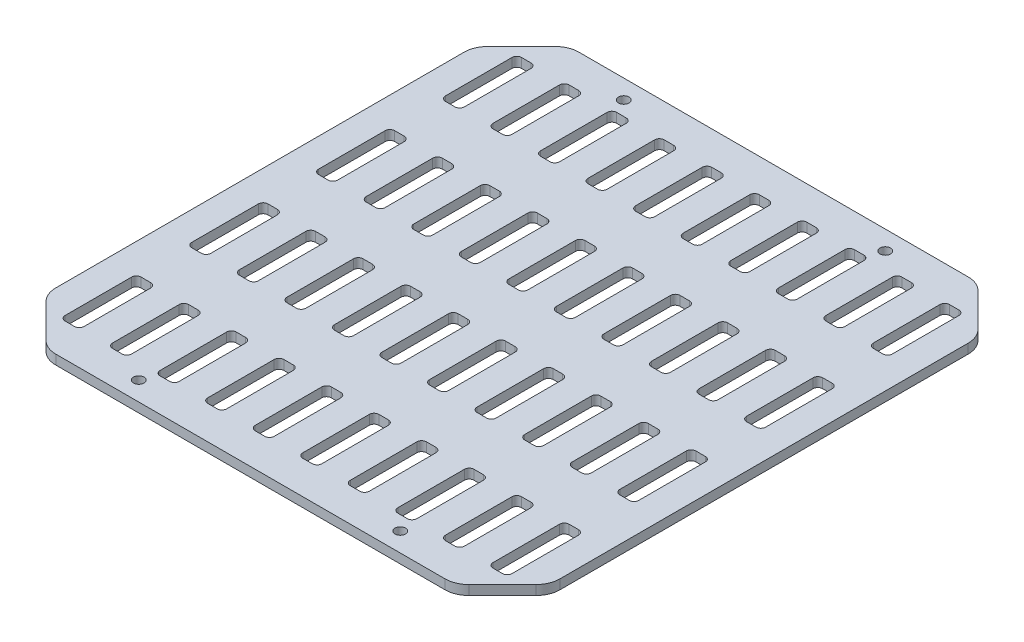
from build123d import *

# Parameters (mm, degrees)
SKETCH_1_W      = 106
SKETCH_1_H      = 110
SKETCH_1_R      = 1.1
SKETCH_1_W_2    = 4
SKETCH_1_H_2    = 16
EXTRUDE_1_DEPTH = 2
CHAMFER_1_SIZE  = 10
FILLET_1_R      = 5
FILLET_2_R      = 1


with BuildPart() as part:
    # 草图1 → 凸台-拉伸1 (new body)
    with BuildSketch(Plane(origin=(0, 0, 0), x_dir=(1, 0, 0), z_dir=(0, 1, 0))):
        Rectangle(SKETCH_1_W, SKETCH_1_H)
        with Locations((-27.5, 51)):
            Circle(SKETCH_1_R, mode=Mode.SUBTRACT)
        with Locations((27.5, 51)):
            Circle(SKETCH_1_R, mode=Mode.SUBTRACT)
        with Locations((27.5, -51)):
            Circle(SKETCH_1_R, mode=Mode.SUBTRACT)
        with Locations((-27.5, -51)):
            Circle(SKETCH_1_R, mode=Mode.SUBTRACT)
        with Locations((-35, 40)):
            Rectangle(SKETCH_1_W_2, SKETCH_1_H_2, mode=Mode.SUBTRACT)
        with Locations((-45, 40)):
            Rectangle(SKETCH_1_W_2, SKETCH_1_H_2, mode=Mode.SUBTRACT)
        with Locations((-25, 40)):
            Rectangle(SKETCH_1_W_2, SKETCH_1_H_2, mode=Mode.SUBTRACT)
        with Locations((-15, 40)):
            Rectangle(SKETCH_1_W_2, SKETCH_1_H_2, mode=Mode.SUBTRACT)
        with Locations((-5, 40)):
            Rectangle(SKETCH_1_W_2, SKETCH_1_H_2, mode=Mode.SUBTRACT)
        with Locations((5, 40)):
            Rectangle(SKETCH_1_W_2, SKETCH_1_H_2, mode=Mode.SUBTRACT)
        with Locations((15, 40)):
            Rectangle(SKETCH_1_W_2, SKETCH_1_H_2, mode=Mode.SUBTRACT)
        with Locations((25, 40)):
            Rectangle(SKETCH_1_W_2, SKETCH_1_H_2, mode=Mode.SUBTRACT)
        with Locations((35, 40)):
            Rectangle(SKETCH_1_W_2, SKETCH_1_H_2, mode=Mode.SUBTRACT)
        with Locations((45, 40)):
            Rectangle(SKETCH_1_W_2, SKETCH_1_H_2, mode=Mode.SUBTRACT)
        with Locations((-35, 13.333333333)):
            Rectangle(SKETCH_1_W_2, SKETCH_1_H_2, mode=Mode.SUBTRACT)
        with Locations((-25, 13.333333333)):
            Rectangle(SKETCH_1_W_2, SKETCH_1_H_2, mode=Mode.SUBTRACT)
        with Locations((-15, 13.333333333)):
            Rectangle(SKETCH_1_W_2, SKETCH_1_H_2, mode=Mode.SUBTRACT)
        with Locations((-5, 13.333333333)):
            Rectangle(SKETCH_1_W_2, SKETCH_1_H_2, mode=Mode.SUBTRACT)
        with Locations((5, 13.333333333)):
            Rectangle(SKETCH_1_W_2, SKETCH_1_H_2, mode=Mode.SUBTRACT)
        with Locations((15, 13.333333333)):
            Rectangle(SKETCH_1_W_2, SKETCH_1_H_2, mode=Mode.SUBTRACT)
        with Locations((25, 13.333333333)):
            Rectangle(SKETCH_1_W_2, SKETCH_1_H_2, mode=Mode.SUBTRACT)
        with Locations((35, 13.333333333)):
            Rectangle(SKETCH_1_W_2, SKETCH_1_H_2, mode=Mode.SUBTRACT)
        with Locations((45, 13.333333333)):
            Rectangle(SKETCH_1_W_2, SKETCH_1_H_2, mode=Mode.SUBTRACT)
        with Locations((-35, -13.333333333)):
            Rectangle(SKETCH_1_W_2, SKETCH_1_H_2, mode=Mode.SUBTRACT)
        with Locations((-25, -13.333333333)):
            Rectangle(SKETCH_1_W_2, SKETCH_1_H_2, mode=Mode.SUBTRACT)
        with Locations((-15, -13.333333333)):
            Rectangle(SKETCH_1_W_2, SKETCH_1_H_2, mode=Mode.SUBTRACT)
        with Locations((-5, -13.333333333)):
            Rectangle(SKETCH_1_W_2, SKETCH_1_H_2, mode=Mode.SUBTRACT)
        with Locations((5, -13.333333333)):
            Rectangle(SKETCH_1_W_2, SKETCH_1_H_2, mode=Mode.SUBTRACT)
        with Locations((15, -13.333333333)):
            Rectangle(SKETCH_1_W_2, SKETCH_1_H_2, mode=Mode.SUBTRACT)
        with Locations((25, -13.333333333)):
            Rectangle(SKETCH_1_W_2, SKETCH_1_H_2, mode=Mode.SUBTRACT)
        with Locations((35, -13.333333333)):
            Rectangle(SKETCH_1_W_2, SKETCH_1_H_2, mode=Mode.SUBTRACT)
        with Locations((45, -13.333333333)):
            Rectangle(SKETCH_1_W_2, SKETCH_1_H_2, mode=Mode.SUBTRACT)
        with Locations((-35, -40)):
            Rectangle(SKETCH_1_W_2, SKETCH_1_H_2, mode=Mode.SUBTRACT)
        with Locations((-25, -40)):
            Rectangle(SKETCH_1_W_2, SKETCH_1_H_2, mode=Mode.SUBTRACT)
        with Locations((-15, -40)):
            Rectangle(SKETCH_1_W_2, SKETCH_1_H_2, mode=Mode.SUBTRACT)
        with Locations((-5, -40)):
            Rectangle(SKETCH_1_W_2, SKETCH_1_H_2, mode=Mode.SUBTRACT)
        with Locations((5, -40)):
            Rectangle(SKETCH_1_W_2, SKETCH_1_H_2, mode=Mode.SUBTRACT)
        with Locations((15, -40)):
            Rectangle(SKETCH_1_W_2, SKETCH_1_H_2, mode=Mode.SUBTRACT)
        with Locations((25, -40)):
            Rectangle(SKETCH_1_W_2, SKETCH_1_H_2, mode=Mode.SUBTRACT)
        with Locations((35, -40)):
            Rectangle(SKETCH_1_W_2, SKETCH_1_H_2, mode=Mode.SUBTRACT)
        with Locations((45, -40)):
            Rectangle(SKETCH_1_W_2, SKETCH_1_H_2, mode=Mode.SUBTRACT)
        with Locations((-45, 13.333333333)):
            Rectangle(SKETCH_1_W_2, SKETCH_1_H_2, mode=Mode.SUBTRACT)
        with Locations((-45, -13.333333333)):
            Rectangle(SKETCH_1_W_2, SKETCH_1_H_2, mode=Mode.SUBTRACT)
        with Locations((-45, -40)):
            Rectangle(SKETCH_1_W_2, SKETCH_1_H_2, mode=Mode.SUBTRACT)
    extrude(amount=EXTRUDE_1_DEPTH)

    # 倒角1
    chamfer_1_edges = [part.edges().sort_by_distance(p)[0] for p in [
        (53, 1, -55),
        (53, 1, 55),
        (-53, 1, 55),
        (-53, 1, -55),
    ]]
    chamfer(chamfer_1_edges, length=CHAMFER_1_SIZE)

    # 圆角1
    fillet_1_edges = [part.edges().sort_by_distance(p)[0] for p in [
        (-53, 1, 45),
        (-43, 1, 55),
        (43, 1, 55),
        (53, 1, 45),
        (53, 1, -45),
        (43, 1, -55),
        (-43, 1, -55),
        (-53, 1, -45),
    ]]
    fillet(fillet_1_edges, radius=FILLET_1_R)

    # 圆角2
    fillet_2_edges = [part.edges().sort_by_distance(p)[0] for p in [
        (-43, 1, 32),
        (-47, 1, 32),
        (-47, 1, 48),
        (-43, 1, 48),
        (-43, 1, 5.333333333),
        (-47, 1, 5.333333333),
        (-47, 1, 21.333333333),
        (-43, 1, 21.333333333),
        (-43, 1, -21.333333333),
        (-47, 1, -21.333333333),
        (-47, 1, -5.333333333),
        (-43, 1, -5.333333333),
        (47, 1, 32),
        (43, 1, 32),
        (43, 1, 48),
        (47, 1, 48),
        (37, 1, 32),
        (33, 1, 32),
        (33, 1, 48),
        (37, 1, 48),
        (27, 1, 32),
        (23, 1, 32),
        (23, 1, 48),
        (27, 1, 48),
        (17, 1, 32),
        (13, 1, 32),
        (13, 1, 48),
        (17, 1, 48),
        (7, 1, 32),
        (3, 1, 32),
        (3, 1, 48),
        (7, 1, 48),
        (-3, 1, 32),
        (-7, 1, 32),
        (-7, 1, 48),
        (-3, 1, 48),
        (-13, 1, 32),
        (-17, 1, 32),
        (-17, 1, 48),
        (-13, 1, 48),
        (-23, 1, 32),
        (-27, 1, 32),
        (-27, 1, 48),
        (-23, 1, 48),
        (-33, 1, 32),
        (-37, 1, 32),
        (-37, 1, 48),
        (-33, 1, 48),
        (47, 1, 5.333333333),
        (43, 1, 5.333333333),
        (43, 1, 21.333333333),
        (47, 1, 21.333333333),
        (37, 1, 5.333333333),
        (33, 1, 5.333333333),
        (33, 1, 21.333333333),
        (37, 1, 21.333333333),
        (27, 1, 5.333333333),
        (23, 1, 5.333333333),
        (23, 1, 21.333333333),
        (27, 1, 21.333333333),
        (17, 1, 5.333333333),
        (13, 1, 5.333333333),
        (13, 1, 21.333333333),
        (17, 1, 21.333333333),
        (7, 1, 5.333333333),
        (3, 1, 5.333333333),
        (3, 1, 21.333333333),
        (7, 1, 21.333333333),
        (-3, 1, 5.333333333),
        (-7, 1, 5.333333333),
        (-7, 1, 21.333333333),
        (-3, 1, 21.333333333),
        (-13, 1, 5.333333333),
        (-17, 1, 5.333333333),
        (-17, 1, 21.333333333),
        (-13, 1, 21.333333333),
        (-23, 1, 5.333333333),
        (-27, 1, 5.333333333),
        (-27, 1, 21.333333333),
        (-23, 1, 21.333333333),
        (-33, 1, 5.333333333),
        (-37, 1, 5.333333333),
        (-37, 1, 21.333333333),
        (-33, 1, 21.333333333),
        (47, 1, -21.333333333),
        (43, 1, -21.333333333),
        (43, 1, -5.333333333),
        (47, 1, -5.333333333),
        (37, 1, -21.333333333),
        (33, 1, -21.333333333),
        (33, 1, -5.333333333),
        (37, 1, -5.333333333),
        (27, 1, -21.333333333),
        (23, 1, -21.333333333),
        (23, 1, -5.333333333),
        (27, 1, -5.333333333),
        (17, 1, -21.333333333),
        (13, 1, -21.333333333),
        (13, 1, -5.333333333),
        (17, 1, -5.333333333),
        (7, 1, -21.333333333),
        (3, 1, -21.333333333),
        (3, 1, -5.333333333),
        (7, 1, -5.333333333),
        (-3, 1, -21.333333333),
        (-7, 1, -21.333333333),
        (-7, 1, -5.333333333),
        (-3, 1, -5.333333333),
        (-13, 1, -21.333333333),
        (-17, 1, -21.333333333),
        (-17, 1, -5.333333333),
        (-13, 1, -5.333333333),
        (-23, 1, -21.333333333),
        (-27, 1, -21.333333333),
        (-27, 1, -5.333333333),
        (-23, 1, -5.333333333),
        (-33, 1, -21.333333333),
        (-37, 1, -21.333333333),
        (-37, 1, -5.333333333),
        (-33, 1, -5.333333333),
        (47, 1, -48),
        (43, 1, -48),
        (43, 1, -32),
        (47, 1, -32),
        (37, 1, -48),
        (33, 1, -48),
        (33, 1, -32),
        (37, 1, -32),
        (27, 1, -48),
        (23, 1, -48),
        (23, 1, -32),
        (27, 1, -32),
        (17, 1, -48),
        (13, 1, -48),
        (13, 1, -32),
        (17, 1, -32),
        (7, 1, -48),
        (3, 1, -48),
        (3, 1, -32),
        (7, 1, -32),
        (-3, 1, -48),
        (-7, 1, -48),
        (-7, 1, -32),
        (-3, 1, -32),
        (-13, 1, -48),
        (-17, 1, -48),
        (-17, 1, -32),
        (-13, 1, -32),
        (-23, 1, -48),
        (-27, 1, -48),
        (-27, 1, -32),
        (-23, 1, -32),
        (-33, 1, -48),
        (-37, 1, -48),
        (-37, 1, -32),
        (-33, 1, -32),
        (-47, 1, -32),
        (-43, 1, -32),
        (-43, 1, -48),
        (-47, 1, -48),
    ]]
    fillet(fillet_2_edges, radius=FILLET_2_R)


solid = part.part
